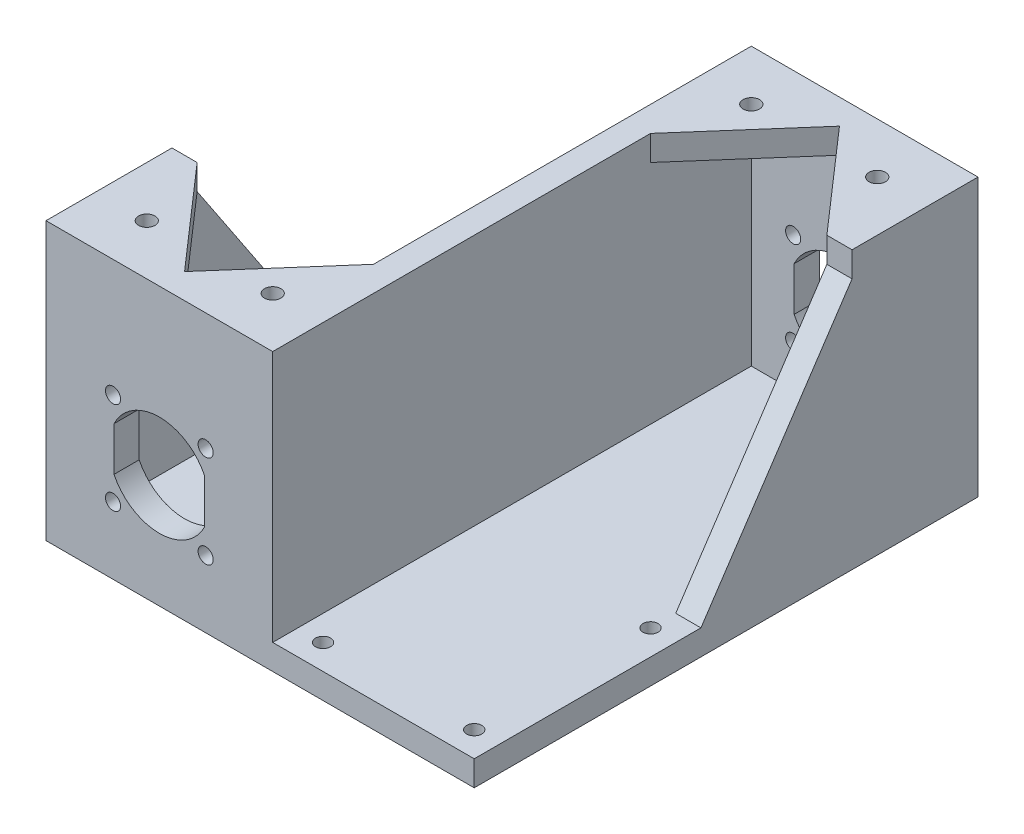
from build123d import *

# Parameters (mm, degrees)
ESQUISSE1_R             = 1.5
EXTRUSION1_DEPTH        = 5
ESQUISSE2_W             = 45
ESQUISSE2_H             = 5
EXTRUSION2_DEPTH        = 95
EXTRUSION3_DEPTH        = 5
ESQUISSE4_W             = 95
ESQUISSE4_H             = 50
EXTRUSION4_DEPTH        = 5
ESQUISSE5_W             = 100
ESQUISSE5_H             = 5
EXTRUSION5_DEPTH        = 40
ESQUISSE6_W             = 40
ESQUISSE6_H             = 50
EXTRUSION6_DEPTH        = 5
EXTRUSION7_DEPTH        = 5
ENL_V_MAT_EXTRU_1_REACH = 124.678
ESQUISSE8_R             = 1.5
ENL_V_MAT_EXTRU_2_REACH = 122.52
ESQUISSE9_R             = 1.5
BOSS_EXTRU_1_DEPTH      = 5
BOSS_EXTRU_2_DEPTH      = 5
D_GAGEMENT_41_D         = 3.2639
D_GAGEMENT_41_DEPTH     = 10
D_GAGEMENT_41_TIP       = 0.980574487


with BuildPart() as part:
    # Esquisse1 → Extrusion1 (new body)
    with BuildSketch(Plane.XY):
        Polygon((0, 0), (45, 0), (45, 45), (45, 55), (0, 55), (0, 45), align=None)
        with Locations((31.692388155, 31.692388155)):
            Circle(ESQUISSE1_R, mode=Mode.SUBTRACT)
        with Locations((31.692388155, 13.307611845)):
            Circle(ESQUISSE1_R, mode=Mode.SUBTRACT)
        with Locations((13.307611845, 13.307611845)):
            Circle(ESQUISSE1_R, mode=Mode.SUBTRACT)
        with Locations((13.307611845, 31.692388155)):
            Circle(ESQUISSE1_R, mode=Mode.SUBTRACT)
        with BuildLine():
            Line((13.5, 26.858898944), (13.5, 18.141101056))
            ThreePointArc((13.5, 18.141101056), (22.5, 12.5), (31.5, 18.141101056))
            Line((31.5, 18.141101056), (31.5, 26.858898944))
            ThreePointArc((31.5, 26.858898944), (22.5, 32.5), (13.5, 26.858898944))
        make_face(mode=Mode.SUBTRACT)
    extrude(amount=EXTRUSION1_DEPTH)

    # Esquisse2 → Extrusion2 (add)
    with BuildSketch(Plane.XY.offset(5)):
        with Locations((22.5, 2.5)):
            Rectangle(ESQUISSE2_W, ESQUISSE2_H)
    extrude(amount=EXTRUSION2_DEPTH)

    # Esquisse3 → Extrusion3 (add)
    with BuildSketch(Plane(origin=(45, 0, 0), x_dir=(0, 0, -1), z_dir=(1, 0, 0))):
        Polygon((-5, 5), (-5, 55), (-25, 55), (-25, 50), (-55, 5), align=None)
    extrude(amount=-EXTRUSION3_DEPTH)

    # Esquisse4 → Extrusion4 (add)
    with BuildSketch(Plane.ZY):
        with Locations((52.5, 30)):
            Rectangle(ESQUISSE4_W, ESQUISSE4_H)
    extrude(amount=-EXTRUSION4_DEPTH)

    # Esquisse5 → Extrusion5 (add)
    with BuildSketch(Plane.ZY):
        with Locations((50, 2.5)):
            Rectangle(ESQUISSE5_W, ESQUISSE5_H)
    extrude(amount=EXTRUSION5_DEPTH)

    # Esquisse6 → Extrusion6 (add)
    with BuildSketch(Plane.XY.offset(100)):
        with Locations((-20, 30)):
            Rectangle(ESQUISSE6_W, ESQUISSE6_H)
    extrude(amount=-EXTRUSION6_DEPTH)

    # Esquisse7 → Extrusion7 (add)
    with BuildSketch(Plane.ZY.offset(40)):
        Polygon((95, 5), (95, 55), (75, 55), (75, 50), (45, 5), align=None)
    extrude(amount=-EXTRUSION7_DEPTH)

    # Esquisse8 → Enlèv. mat.-Extru.1 (cut, up to next)
    with BuildSketch(Plane.XY.offset(100), mode=Mode.PRIVATE) as enl_v_mat_extru_1_sk1:
        with Locations((-8.307611845, 13.307611845)):
            Circle(ESQUISSE8_R)
    enl_v_mat_extru_1_tool1 = extrude(enl_v_mat_extru_1_sk1.sketch, amount=-ENL_V_MAT_EXTRU_1_REACH, mode=Mode.PRIVATE) & part.part
    # Esquisse8 → Enlèv. mat.-Extru.1 (cut, up to next)
    with BuildSketch(Plane.XY.offset(100), mode=Mode.PRIVATE) as enl_v_mat_extru_1_sk2:
        with Locations((-8.307611845, 31.692388155)):
            Circle(ESQUISSE8_R)
    enl_v_mat_extru_1_tool2 = extrude(enl_v_mat_extru_1_sk2.sketch, amount=-ENL_V_MAT_EXTRU_1_REACH, mode=Mode.PRIVATE) & part.part
    # Esquisse8 → Enlèv. mat.-Extru.1 (cut, up to next)
    with BuildSketch(Plane.XY.offset(100), mode=Mode.PRIVATE) as enl_v_mat_extru_1_sk3:
        with Locations((-26.692388155, 31.692388155)):
            Circle(ESQUISSE8_R)
    enl_v_mat_extru_1_tool3 = extrude(enl_v_mat_extru_1_sk3.sketch, amount=-ENL_V_MAT_EXTRU_1_REACH, mode=Mode.PRIVATE) & part.part
    # Esquisse8 → Enlèv. mat.-Extru.1 (cut, up to next)
    with BuildSketch(Plane.XY.offset(100), mode=Mode.PRIVATE) as enl_v_mat_extru_1_sk4:
        with Locations((-26.692388155, 13.307611845)):
            Circle(ESQUISSE8_R)
    enl_v_mat_extru_1_tool4 = extrude(enl_v_mat_extru_1_sk4.sketch, amount=-ENL_V_MAT_EXTRU_1_REACH, mode=Mode.PRIVATE) & part.part
    # Esquisse8 → Enlèv. mat.-Extru.1 (cut, up to next)
    with BuildSketch(Plane.XY.offset(100), mode=Mode.PRIVATE) as enl_v_mat_extru_1_sk5:
        with BuildLine():
            Line((-26.5, 18.141101056), (-26.5, 26.858898944))
            ThreePointArc((-26.5, 26.858898944), (-17.5, 32.5), (-8.5, 26.858898944))
            Line((-8.5, 26.858898944), (-8.5, 18.141101056))
            ThreePointArc((-8.5, 18.141101056), (-17.5, 12.5), (-26.5, 18.141101056))
        make_face()
    enl_v_mat_extru_1_tool5 = extrude(enl_v_mat_extru_1_sk5.sketch, amount=-ENL_V_MAT_EXTRU_1_REACH, mode=Mode.PRIVATE) & part.part
    add(enl_v_mat_extru_1_tool1.solids().sort_by_distance((-8.307612, 13.307612, 100))[0], mode=Mode.SUBTRACT)
    add(enl_v_mat_extru_1_tool2.solids().sort_by_distance((-8.307612, 31.692388, 100))[0], mode=Mode.SUBTRACT)
    add(enl_v_mat_extru_1_tool3.solids().sort_by_distance((-26.692388, 31.692388, 100))[0], mode=Mode.SUBTRACT)
    add(enl_v_mat_extru_1_tool4.solids().sort_by_distance((-26.692388, 13.307612, 100))[0], mode=Mode.SUBTRACT)
    add(enl_v_mat_extru_1_tool5.solids().sort_by_distance((-17.5, 22.5, 100))[0], mode=Mode.SUBTRACT)

    # Esquisse9 → Enlèv. mat.-Extru.2 (cut, up to next)
    with BuildSketch(Plane(origin=(0, 5, 0), x_dir=(-1, 0, 0), z_dir=(0, 1, 0)), mode=Mode.PRIVATE) as enl_v_mat_extru_2_sk1:
        with Locations((-40, 95)):
            Circle(ESQUISSE9_R)
    enl_v_mat_extru_2_tool1 = extrude(enl_v_mat_extru_2_sk1.sketch, amount=-ENL_V_MAT_EXTRU_2_REACH, mode=Mode.PRIVATE) & part.part
    # Esquisse9 → Enlèv. mat.-Extru.2 (cut, up to next)
    with BuildSketch(Plane(origin=(0, 5, 0), x_dir=(-1, 0, 0), z_dir=(0, 1, 0)), mode=Mode.PRIVATE) as enl_v_mat_extru_2_sk2:
        with Locations((-10, 95)):
            Circle(ESQUISSE9_R)
    enl_v_mat_extru_2_tool2 = extrude(enl_v_mat_extru_2_sk2.sketch, amount=-ENL_V_MAT_EXTRU_2_REACH, mode=Mode.PRIVATE) & part.part
    # Esquisse9 → Enlèv. mat.-Extru.2 (cut, up to next)
    with BuildSketch(Plane(origin=(0, 5, 0), x_dir=(-1, 0, 0), z_dir=(0, 1, 0)), mode=Mode.PRIVATE) as enl_v_mat_extru_2_sk3:
        with Locations((35, 5)):
            Circle(ESQUISSE9_R)
    enl_v_mat_extru_2_tool3 = extrude(enl_v_mat_extru_2_sk3.sketch, amount=-ENL_V_MAT_EXTRU_2_REACH, mode=Mode.PRIVATE) & part.part
    # Esquisse9 → Enlèv. mat.-Extru.2 (cut, up to next)
    with BuildSketch(Plane(origin=(0, 5, 0), x_dir=(-1, 0, 0), z_dir=(0, 1, 0)), mode=Mode.PRIVATE) as enl_v_mat_extru_2_sk4:
        with Locations((5, 5)):
            Circle(ESQUISSE9_R)
    enl_v_mat_extru_2_tool4 = extrude(enl_v_mat_extru_2_sk4.sketch, amount=-ENL_V_MAT_EXTRU_2_REACH, mode=Mode.PRIVATE) & part.part
    # Esquisse9 → Enlèv. mat.-Extru.2 (cut, up to next)
    with BuildSketch(Plane(origin=(0, 5, 0), x_dir=(-1, 0, 0), z_dir=(0, 1, 0)), mode=Mode.PRIVATE) as enl_v_mat_extru_2_sk5:
        with Locations((-40, 60)):
            Circle(ESQUISSE9_R)
    enl_v_mat_extru_2_tool5 = extrude(enl_v_mat_extru_2_sk5.sketch, amount=-ENL_V_MAT_EXTRU_2_REACH, mode=Mode.PRIVATE) & part.part
    # Esquisse9 → Enlèv. mat.-Extru.2 (cut, up to next)
    with BuildSketch(Plane(origin=(0, 5, 0), x_dir=(-1, 0, 0), z_dir=(0, 1, 0)), mode=Mode.PRIVATE) as enl_v_mat_extru_2_sk6:
        with Locations((35, 40)):
            Circle(ESQUISSE9_R)
    enl_v_mat_extru_2_tool6 = extrude(enl_v_mat_extru_2_sk6.sketch, amount=-ENL_V_MAT_EXTRU_2_REACH, mode=Mode.PRIVATE) & part.part
    add(enl_v_mat_extru_2_tool1.solids().sort_by_distance((40, 5, 95))[0], mode=Mode.SUBTRACT)
    add(enl_v_mat_extru_2_tool2.solids().sort_by_distance((10, 5, 95))[0], mode=Mode.SUBTRACT)
    add(enl_v_mat_extru_2_tool3.solids().sort_by_distance((-35, 5, 5))[0], mode=Mode.SUBTRACT)
    add(enl_v_mat_extru_2_tool4.solids().sort_by_distance((-5, 5, 5))[0], mode=Mode.SUBTRACT)
    add(enl_v_mat_extru_2_tool5.solids().sort_by_distance((40, 5, 60))[0], mode=Mode.SUBTRACT)
    add(enl_v_mat_extru_2_tool6.solids().sort_by_distance((-35, 5, 40))[0], mode=Mode.SUBTRACT)

    # Esquisse11 → Boss.-Extru.1 (add)
    with BuildSketch(Plane(origin=(0, 55, 0), x_dir=(1, 0, 0), z_dir=(0, 1, 0))):
        Polygon((22.5, -5), (5, -25), (5, 0), (40, 0), (40, -25), align=None)
    extrude(amount=-BOSS_EXTRU_1_DEPTH)

    # Esquisse12 → Boss.-Extru.2 (add)
    with BuildSketch(Plane(origin=(0, 55, 0), x_dir=(1, 0, 0), z_dir=(0, 1, 0))):
        Polygon((0, -75), (-17.5, -95), (-35, -75), (-35, -100), (0, -100), align=None)
    extrude(amount=-BOSS_EXTRU_2_DEPTH)

    # Dégagement #41
    with Locations(Plane(origin=(0, 55, 0), x_dir=(-1, 0, 0), z_dir=(0, 1, 0))):
        with Locations((-10, 10), (-35, 10), (30, 90), (5, 90)):
            Hole(D_GAGEMENT_41_D / 2, depth=D_GAGEMENT_41_DEPTH)
            with Locations((0, 0, -(D_GAGEMENT_41_DEPTH + D_GAGEMENT_41_TIP / 2))):  # 118° drill point
                Cone(0, D_GAGEMENT_41_D / 2, D_GAGEMENT_41_TIP, mode=Mode.SUBTRACT)


solid = part.part
